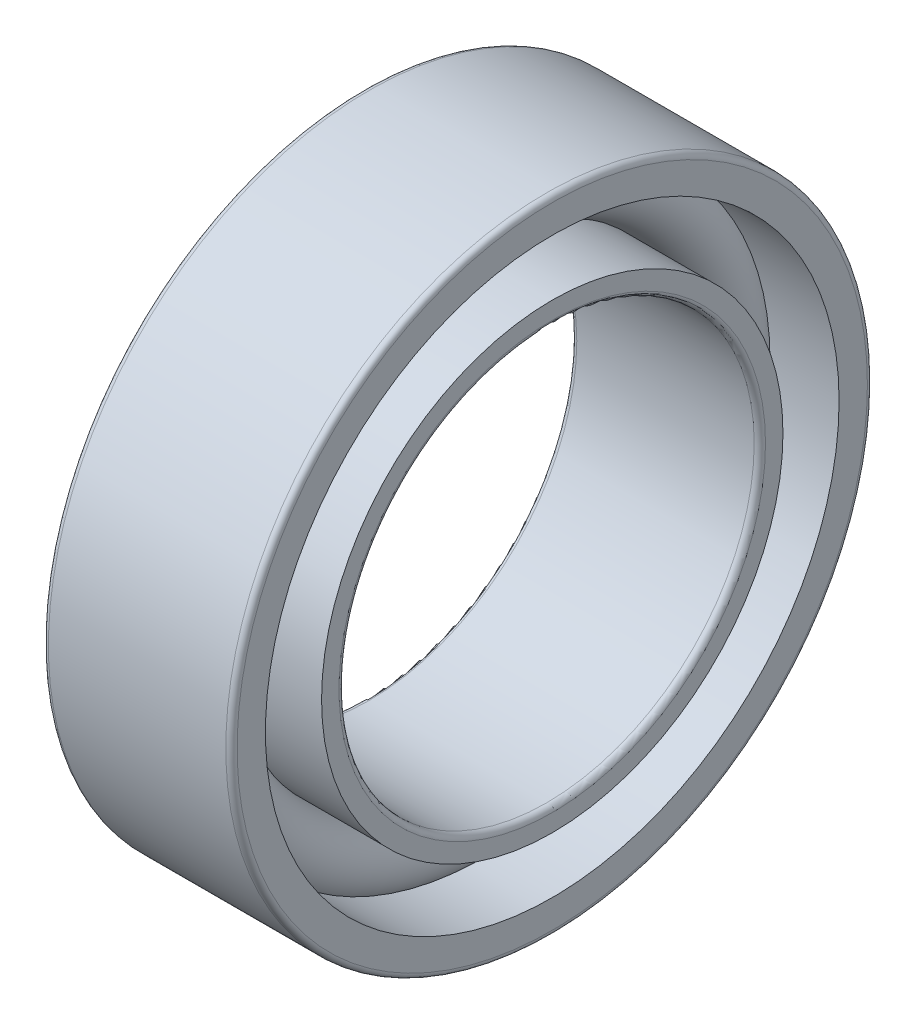
from build123d import *

# Parameters (mm, degrees)
CAGSPISKE_W     = 0.9
CAGSPISKE_H     = 0.6
CAGESPINE_ANGLE = 0.001
BALSIMSKE_R     = 1.8


with BuildPart() as part:
    # CagSpiSke → CageSpine (revolve)
    with BuildSketch(Plane.XY):
        with Locations((0, 14)):
            Rectangle(CAGSPISKE_W, CAGSPISKE_H)
    revolve(axis=Axis((-20.6375, 0, 0), (1, 0, 0)), revolution_arc=CAGESPINE_ANGLE)

    # BalSimSke → BallsSimplified (revolve)
    with BuildSketch(Plane.XY):
        with Locations((0, 14)):
            Circle(BALSIMSKE_R)
    revolve(axis=Axis((-10, 0, 0), (1, 0, 0)))

    # InnRacSke → InnerRace (revolve)
    with BuildSketch(Plane.XY):
        with BuildLine():
            Line((-1.307908636, 12.8), (-5, 12.8))
            Line((-5, 12.8), (-5, 11.3))
            ThreePointArc((-5, 11.3), (-4.912132034, 11.087867966), (-4.7, 11))
            Line((-4.7, 11), (4.7, 11))
            ThreePointArc((4.7, 11), (4.912132034, 11.087867966), (5, 11.3))
            Line((5, 11.3), (5, 12.225))
            Line((5, 12.225), (0, 12.225))
            ThreePointArc((0, 12.225), (-0.714361603, 12.375096157), (-1.307908636, 12.8))
        make_face()
    revolve(axis=Axis((-20.6375, 0, 0), (1, 0, 0)))

    # OutRacSke → OuterRace (revolve)
    with BuildSketch(Plane.XY):
        with BuildLine():
            Line((0, 15.775), (-5, 15.775))
            Line((-5, 15.775), (-5, 16.7))
            ThreePointArc((-5, 16.7), (-4.912132034, 16.912132034), (-4.7, 17))
            Line((-4.7, 17), (4.7, 17))
            ThreePointArc((4.7, 17), (4.912132034, 16.912132034), (5, 16.7))
            Line((5, 16.7), (5, 15.2))
            Line((5, 15.2), (1.307908636, 15.2))
            ThreePointArc((1.307908636, 15.2), (0.714361603, 15.624903843), (0, 15.775))
        make_face()
    revolve(axis=Axis((-20.6375, 0, 0), (1, 0, 0)))


solid = part.part
